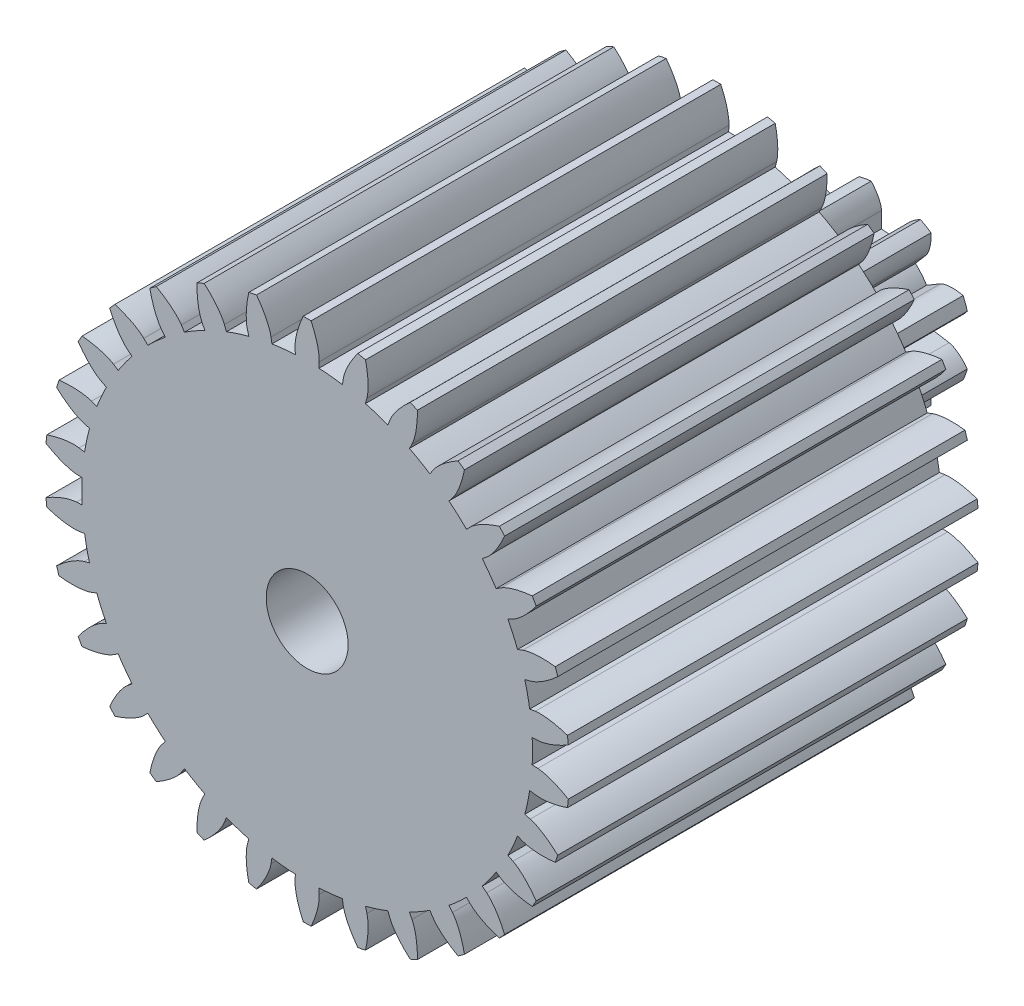
from build123d import *

# Parameters (mm, degrees)
SKETCH_1_R               = 2.2
SKETCH_1_R_2             = 1
EXTRUDE_1_DEPTH          = 4
CUT_EXTRUDE_1_DEPTH      = 6.067543784
PATTERN_CIRCULAR_1_COUNT = 9
PATTERN_CIRCULAR_1_ANGLE = 320
SKETCH_2_R               = 6.4
SKETCH_2_R_2             = 1
EXTRUDE_2_DEPTH          = 10
CUT_EXTRUDE_3_DEPTH      = 14.487772335
PATTERN_CIRCULAR_2_COUNT = 30


with BuildPart() as part:
    # 草图1 → 凸台-拉伸1 (new body)
    with BuildSketch(Plane.XY):
        Circle(SKETCH_1_R)
        Circle(SKETCH_1_R_2, mode=Mode.SUBTRACT)
    extrude(amount=EXTRUDE_1_DEPTH)

    # 草图1<3> → 切除-拉伸1 (cut, through all)
    with BuildSketch(Plane.XY):
        with BuildLine():
            Line((1.668777663, 0.275994764), (1.28257718, 0.212122078))
            ThreePointArc((1.28257718, 0.212122078), (1.295636974, 0.106418197), (1.3, 0))
            ThreePointArc((1.3, 0), (1.295636974, -0.106418197), (1.28257718, -0.212122078))
            Line((1.28257718, -0.212122078), (1.668777663, -0.275994764))
            add(Edge.make_bspline(
                [(1.668777663, -0.275994764), (1.681496761, -0.278098342), (1.716538761, -0.28672295), (1.780373215, -0.313392423), (1.876895792, -0.370481257), (1.976755221, -0.452857378), (2.049489285, -0.529748795), (2.095568426, -0.586317158), (2.113743491, -0.609990535)],
                knots=[0, 0, 0, 0, 0, 0.005604068, 0.015718248, 0.029959916, 0.048733667, 0.061737159, 0.061737159, 0.061737159, 0.061737159, 0.061737159], degree=4))
            ThreePointArc((2.113743491, -0.609990535), (2.17832914, -0.308029478), (2.2, 0))
            ThreePointArc((2.2, 0), (2.17832914, 0.308029478), (2.113743491, 0.609990535))
            add(Edge.make_bspline(
                [(1.668777663, 0.275994764), (1.681496761, 0.278098342), (1.716538761, 0.28672295), (1.780373215, 0.313392423), (1.876895792, 0.370481257), (1.976755221, 0.452857378), (2.049489285, 0.529748795), (2.095568426, 0.586317158), (2.113743491, 0.609990535)],
                knots=[0, 0, 0, 0, 0, 0.005604068, 0.015718248, 0.029959916, 0.048733667, 0.061737159, 0.061737159, 0.061737159, 0.061737159, 0.061737159], degree=4))
        make_face()
    cut_extrude_1 = extrude(amount=CUT_EXTRUDE_1_DEPTH, mode=Mode.SUBTRACT)

    # 阵列(圆周)1: 切除-拉伸1 ×9 about axis
    pattern_circular_1_axis = Axis((0, 0, 4), (0, 0, 1))
    for i in range(1, PATTERN_CIRCULAR_1_COUNT):
        add(cut_extrude_1.rotate(pattern_circular_1_axis, i * PATTERN_CIRCULAR_1_ANGLE / (PATTERN_CIRCULAR_1_COUNT - 1)), mode=Mode.SUBTRACT)

    # 草图2 → 凸台-拉伸2 (add)
    with BuildSketch(Plane.XY.offset(4)):
        Circle(SKETCH_2_R)
        Circle(SKETCH_2_R_2, mode=Mode.SUBTRACT)
    extrude(amount=EXTRUDE_2_DEPTH)

    # 草图2<3> → 切除-拉伸3 (cut, through all)
    with BuildSketch(Plane.XY.offset(4)):
        with BuildLine():
            Line((5.630428828, 0.295078271), (5.492462441, 0.287847759))
            ThreePointArc((5.492462441, 0.287847759), (5.498115287, 0.143973216), (5.5, 0))
            ThreePointArc((5.5, 0), (5.498115287, -0.143973216), (5.492462441, -0.287847759))
            Line((5.492462441, -0.287847759), (5.630428828, -0.295078271))
            add(Edge.make_bspline(
                [(5.630428828, -0.295078271), (5.651865751, -0.296201733), (5.6945181, -0.30045408), (5.812908276, -0.322863873), (6.004188265, -0.383416301), (6.167526736, -0.456962726), (6.30561421, -0.532368385), (6.374290296, -0.57308221)],
                knots=[0, 0, 0, 0, 0, 0.002802034, 0.005604068, 0.015718248, 0.026152267, 0.026152267, 0.026152267, 0.026152267, 0.026152267], degree=4))
            ThreePointArc((6.374290296, -0.57308221), (6.393569343, -0.286829308), (6.4, 0))
            ThreePointArc((6.4, 0), (6.393569343, 0.286829308), (6.374290296, 0.57308221))
            add(Edge.make_bspline(
                [(5.630428828, 0.295078271), (5.651865751, 0.296201733), (5.6945181, 0.30045408), (5.812908276, 0.322863873), (6.004188265, 0.383416301), (6.167526736, 0.456962726), (6.30561421, 0.532368385), (6.374290296, 0.57308221)],
                knots=[0, 0, 0, 0, 0, 0.002802034, 0.005604068, 0.015718248, 0.026152267, 0.026152267, 0.026152267, 0.026152267, 0.026152267], degree=4))
        make_face()
    cut_extrude_3 = extrude(amount=CUT_EXTRUDE_3_DEPTH, mode=Mode.SUBTRACT)

    # 阵列(圆周)2: 切除-拉伸3 ×30 about axis
    pattern_circular_2_axis = Axis((0, 0, 14), (0, 0, 1))
    for i in range(1, PATTERN_CIRCULAR_2_COUNT):
        add(cut_extrude_3.rotate(pattern_circular_2_axis, i * 360 / PATTERN_CIRCULAR_2_COUNT), mode=Mode.SUBTRACT)


solid = part.part
